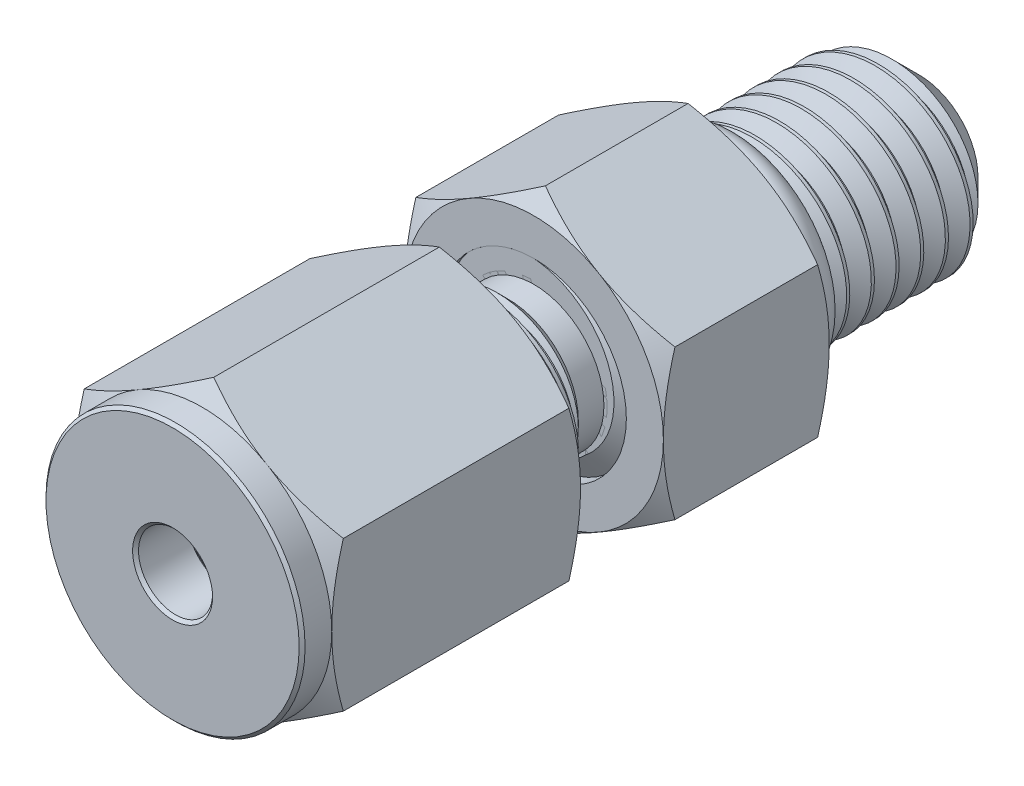
from build123d import *

# Parameters (mm, degrees)
BOSS_EXTRUDE1_DEPTH = 11.938
CHAMFER1_SIZE       = 0.127
SKETCH4_W           = 16.002
SKETCH4_H           = 3.96875
BOSS_EXTRUDE2_DEPTH = 7.112
SKETCH11_W          = 9.398
SKETCH11_H          = 3.96875
SKETCH15_R          = 0.8128
SKETCH17_OUTSIDE_W  = 107.468
SKETCH17_OUTSIDE_H  = 109.188
SKETCH17_OUTSIDE_R  = 5.55625
CUT_EXTRUDE1_DEPTH  = 25.146753449
CUT_EXTRUDE1_DRAFT  = -60
SKETCH18_OUTSIDE_W  = 88.128
SKETCH18_OUTSIDE_H  = 89.848
SKETCH18_OUTSIDE_R  = 5.55625
CUT_EXTRUDE2_DEPTH  = 19.563797191
CUT_EXTRUDE2_DRAFT  = -60
CHAMFER2_SIZE       = 1.42875
CUT_SWEEP1_PITCH    = 1.27
CUT_SWEEP2_PITCH    = 1.058333333
SKETCH19_W          = 7.112
SKETCH19_H          = 0.824889197


with BuildPart() as part:
    # Sketch2 → Boss-Extrude1 (new body)
    with BuildSketch(Plane.XY):
        Polygon((0, 6.415804866), (-5.55625, 3.207902433), (-5.55625, -3.207902433), (0, -6.415804866), (5.55625, -3.207902433), (5.55625, 3.207902433), align=None)
    extrude(amount=-BOSS_EXTRUDE1_DEPTH)

    # Sketch3 → Cut-Revolve1 (revolve, cut)
    with BuildSketch(Plane(origin=(0, 0, 0), x_dir=(0, 0, -1), z_dir=(1, 0, 0)), mode=Mode.PRIVATE) as cut_revolve1_sk:
        Polygon((0, 6.415804866), (0, 5.55625), (1.27, 5.55625), (1.766264233, 6.415804866), (11.441735767, 6.415804866), (11.938, 5.55625), (11.938, 6.415804866), (11.938, 7.275359733), (0, 7.275359733), align=None)
        Polygon((0, 1.5875), (0, 0), (11.938, 0), (11.938, 3.96875), (4.7752, 3.96875), (4.7752, 3.33375), (2.3876, 3.33375), (2.3876, 2.69875), (2.3876, 1.5875), align=None)
    revolve(cut_revolve1_sk.sketch.rotate(Axis((0, 0, 0), (0, 0, -1)), 90), axis=Axis((0, 0, 0), (0, 0, -1)), mode=Mode.SUBTRACT)

    # Chamfer1
    chamfer1_edges = [part.edges().sort_by_distance(p)[0] for p in [
        (-5.55625, 0, 0),
        (-1.5875, 0, -2.3876),
        (-1.5875, 0, 0),
    ]]
    chamfer(chamfer1_edges, length=CHAMFER1_SIZE)


with BuildPart() as body_2:
    # Sketch4 → Revolve1 (revolve)
    with BuildSketch(Plane(origin=(0, 0, 0), x_dir=(0, 0, -1), z_dir=(1, 0, 0)), mode=Mode.PRIVATE) as revolve1_sk:
        with Locations((14.605, 1.984375)):
            Rectangle(SKETCH4_W, SKETCH4_H)
    revolve(revolve1_sk.sketch.rotate(Axis((0, 0, -22.606), (0, 0, 1)), 90), axis=Axis((0, 0, -22.606), (0, 0, 1)))


with BuildPart() as body_3:
    # Sketch7 → Boss-Extrude2 (new body)
    with BuildSketch(Plane(origin=(0, 0, -22.606), x_dir=(-1, 0, 0), z_dir=(0, 0, -1))):
        Polygon((0, 6.415804866), (-5.55625, 3.207902433), (-5.55625, -3.207902433), (0, -6.415804866), (5.55625, -3.207902433), (5.55625, 3.207902433), align=None)
    extrude(amount=-BOSS_EXTRUDE2_DEPTH)


with BuildPart() as body_4:
    # Sketch9 → Revolve2 (revolve)
    with BuildSketch(Plane(origin=(0, 0, 0), x_dir=(0, 0, -1), z_dir=(1, 0, 0)), mode=Mode.PRIVATE) as revolve2_sk:
        Polygon((4.2926, 3.0988), (4.2926, 2.2733), (4.9784, 1.5875), (9.1694, 1.5875), (9.1694, 1.9812), align=None)
    revolve(revolve2_sk.sketch.rotate(Axis((0, 0, 0), (0, 0, -1)), 90), axis=Axis((0, 0, 0), (0, 0, -1)))


with BuildPart() as body_5:
    # Sketch10 → Revolve3 (revolve)
    with BuildSketch(Plane(origin=(0, 0, 0), x_dir=(0, 0, -1), z_dir=(1, 0, 0)), mode=Mode.PRIVATE) as revolve3_sk:
        Polygon((2.3876, 3.0734), (3.4036, 3.0734), (3.4036, 2.2733), (4.2926, 2.2733), (4.9784, 1.5875), (2.3876, 1.5875), align=None)
    revolve(revolve3_sk.sketch.rotate(Axis((0, 0, 0), (0, 0, -1)), 90), axis=Axis((0, 0, 0), (0, 0, -1)))


with BuildPart() as body_6:
    # Sketch11 → Revolve4 (revolve)
    with BuildSketch(Plane(origin=(0, 0, 0), x_dir=(0, 0, -1), z_dir=(1, 0, 0)), mode=Mode.PRIVATE) as revolve4_sk:
        with Locations((27.305, 1.984375)):
            Rectangle(SKETCH11_W, SKETCH11_H)
    revolve(revolve4_sk.sketch.rotate(Axis((0, 0, -22.606), (0, 0, -1)), 90), axis=Axis((0, 0, -22.606), (0, 0, -1)))


with BuildPart() as body_7:
    # Sketch15 → Revolve5 (revolve)
    with BuildSketch(Plane(origin=(0, 0, 0), x_dir=(0, 0, -1), z_dir=(1, 0, 0)), mode=Mode.PRIVATE) as revolve5_sk:
        with Locations((23.4188, 3.8481)):
            Circle(SKETCH15_R)
    revolve(revolve5_sk.sketch.rotate(Axis((0, 0, 0), (0, 0, -1)), 270), axis=Axis((0, 0, 0), (0, 0, -1)))


with BuildPart() as cut_extrude1_tool:
    # Sketch17 outside → Cut-Extrude1 (with draft: the straight prism first)
    with BuildSketch(Plane(origin=(0, 0, -22.606), x_dir=(-1, 0, 0), z_dir=(0, 0, -1))):
        Rectangle(SKETCH17_OUTSIDE_W, SKETCH17_OUTSIDE_H)
        with Locations(Location((0, 0, 0), (0, 0, 180))):
            Circle(SKETCH17_OUTSIDE_R, mode=Mode.SUBTRACT)
    extrude(amount=-CUT_EXTRUDE1_DEPTH)
    # Cut-Extrude1: the draft: its side faces are tilted about the plane it starts from
    cut_extrude1_sides = [cut_extrude1_tool.faces().sort_by_distance(p)[0] for p in [
        (0, -54.594, -10.032623275),
        (-53.734, 0, -10.032623275),
        (0, 54.594, -10.032623275),
        (53.734, 0, -10.032623275),
        (-5.55625, 0, -10.032623275),
    ]]
    draft(cut_extrude1_sides, Plane(origin=(0, 0, -22.606), x_dir=(-1, 0, 0), z_dir=(0, 0, -1)), CUT_EXTRUDE1_DRAFT)


with BuildPart() as body_3_1:
    add(body_3.part)

    # Cut-Extrude1: cut by cut_extrude1_tool
    add(cut_extrude1_tool.part, mode=Mode.SUBTRACT)


with BuildPart() as cut_extrude2_tool:
    # Sketch18 outside → Cut-Extrude2 (with draft: the straight prism first)
    with BuildSketch(Plane.XY.offset(-15.494)):
        Rectangle(SKETCH18_OUTSIDE_W, SKETCH18_OUTSIDE_H)
        Circle(SKETCH18_OUTSIDE_R, mode=Mode.SUBTRACT)
    extrude(amount=-CUT_EXTRUDE2_DEPTH)
    # Cut-Extrude2: the draft: its side faces are tilted about the plane it starts from
    cut_extrude2_sides = [cut_extrude2_tool.faces().sort_by_distance(p)[0] for p in [
        (0, -44.924, -25.275898595),
        (44.064, 0, -25.275898595),
        (0, 44.924, -25.275898595),
        (-44.064, 0, -25.275898595),
        (-5.55625, 0, -25.275898595),
    ]]
    draft(cut_extrude2_sides, Plane.XY.offset(-15.494), CUT_EXTRUDE2_DRAFT)


with BuildPart() as body_3_2:
    add(body_3_1.part)

    # Cut-Extrude2: cut by cut_extrude2_tool
    add(cut_extrude2_tool.part, mode=Mode.SUBTRACT)


with BuildPart() as cut_revolve5_tool:
    # Sketch16 → Cut-Revolve5 (revolve)
    with BuildSketch(Plane(origin=(0, 0, 0), x_dir=(0, 0, -1), z_dir=(1, 0, 0))):
        Polygon((32.004, 0), (6.604, 0), (6.604, 2.569104167), (10.887363636, 1.5875), (12.7, 1.5875), (12.7, 1.1811), (32.004, 1.1811), (33.5915, 1.1811), (33.5915, 0), align=None)
    revolve(axis=Axis((0, 0, -32.004), (0, 0, 1)))


with BuildPart() as body_3_3:
    add(body_3_2.part)

    # Cut-Revolve5: cut by cut_revolve5_tool
    add(cut_revolve5_tool.part, mode=Mode.SUBTRACT)

    # Sketch19 → Cut-Revolve7 (revolve, cut)
    with BuildSketch(Plane(origin=(0, 0, 0), x_dir=(0, 0, -1), z_dir=(1, 0, 0)), mode=Mode.PRIVATE) as cut_revolve7_sk:
        with Locations((19.05, 3.556305402)):
            Rectangle(SKETCH19_W, SKETCH19_H)
    revolve(cut_revolve7_sk.sketch.rotate(Axis((0, 0, 0), (0, 0, -1)), 90), axis=Axis((0, 0, 0), (0, 0, -1)), mode=Mode.SUBTRACT)


with BuildPart() as body_2_1:
    add(body_2.part)

    # Cut-Revolve5: cut by cut_revolve5_tool
    add(cut_revolve5_tool.part, mode=Mode.SUBTRACT)

    # Cut-Sweep1: the profile of Sketch6 screwed along a right-hand helix of 13.6 turns, 8 arcs to a turn; built about Z, then put on its axis
    cut_sweep1_z = Axis((0, 0, 0), (0, 0, 1))
    cut_sweep1_corners = [(3.143860803, 0, -0.635), (4.037490766, 0, -1.1509375), (4.037490766, 0, 0.0396875), (3.143860803, 0, -0.47625)]
    with BuildLine(mode=Mode.PRIVATE) as cut_sweep1_profile:
        Line(cut_sweep1_corners[0], cut_sweep1_corners[1])
        Line(cut_sweep1_corners[1], cut_sweep1_corners[2])
        Line(cut_sweep1_corners[2], cut_sweep1_corners[3])
        Line(cut_sweep1_corners[3], cut_sweep1_corners[0])
    cut_sweep1_cap = Face(cut_sweep1_profile.wire())
    cut_sweep1_turn_angles = [0, 22.5, 45, 67.5, 90, 112.5, 135, 157.5, 180, 202.5, 225, 247.5, 270, 292.5, 315, 337.5, 360]
    cut_sweep1_turn_weights = [1, 0.9238795325112867, 1, 0.9238795325112867, 1, 0.9238795325112867, 1, 0.9238795325112867, 1, 0.9238795325112867, 1, 0.9238795325112867, 1, 0.9238795325112867, 1, 0.9238795325112867, 1]
    cut_sweep1_turn_rails = [Edge.make_bspline([Vector(p[0], p[1], 0).rotate(cut_sweep1_z, cut_sweep1_turn_angles[k]) / cut_sweep1_turn_weights[k] + Vector(0, 0, p[2] + CUT_SWEEP1_PITCH * cut_sweep1_turn_angles[k] / 360) for k in range(17)], [0, 0, 0, 1, 1, 2, 2, 3, 3, 4, 4, 5, 5, 6, 6, 7, 7, 8, 8, 8], 2, cut_sweep1_turn_weights) for p in cut_sweep1_corners]
    cut_sweep1_turn_sides = [Face.make_surface_from_curves(cut_sweep1_turn_rails[p[0]], cut_sweep1_turn_rails[p[1]]) for p in [(0, 1), (1, 2), (2, 3), (3, 0)]]
    cut_sweep1_last_angles = [4680, 4702.5, 4725, 4747.5, 4770, 4792.5, 4815, 4837.5, 4860, 4878, 4896]
    cut_sweep1_last_weights = [1, 0.9238795325112867, 1, 0.9238795325112867, 1, 0.9238795325112867, 1, 0.9238795325112867, 1, 0.9510565162951486, 1]
    cut_sweep1_last_rails = [Edge.make_bspline([Vector(p[0], p[1], 0).rotate(cut_sweep1_z, cut_sweep1_last_angles[k]) / cut_sweep1_last_weights[k] + Vector(0, 0, p[2] + CUT_SWEEP1_PITCH * cut_sweep1_last_angles[k] / 360) for k in range(11)], [0, 0, 0, 1, 1, 2, 2, 3, 3, 4, 4, 5, 5, 5], 2, cut_sweep1_last_weights) for p in cut_sweep1_corners]
    cut_sweep1_last_sides = [Face.make_surface_from_curves(cut_sweep1_last_rails[p[0]], cut_sweep1_last_rails[p[1]]) for p in [(0, 1), (1, 2), (2, 3), (3, 0)]]
    cut_sweep1 = Plane(origin=(0, 0, -6.604), x_dir=(0, 1, 0), z_dir=(0, 0, -1)) * Solid(Shell([*[p.moved(Location((0, 0, CUT_SWEEP1_PITCH * i))) for i in range(13) for p in cut_sweep1_turn_sides], *cut_sweep1_last_sides, cut_sweep1_cap, cut_sweep1_cap.rotate(cut_sweep1_z, 4896).moved(Location((0, 0, CUT_SWEEP1_PITCH * 4896 / 360)))]))
    add(cut_sweep1, mode=Mode.SUBTRACT)

    # Sketch8 → Cut-Revolve2 (revolve, cut)
    with BuildSketch(Plane(origin=(0, 0, 0), x_dir=(0, 0, -1), z_dir=(1, 0, 0)), mode=Mode.PRIVATE) as cut_revolve2_sk:
        Polygon((6.604, 4.106231533), (6.604, 3.00637927), (7.703852263, 4.106231533), align=None)
        Polygon((15.494, 4.106231533), (13.294295474, 4.106231533), (14.394147737, 3.00637927), (15.494, 3.00637927), align=None)
    revolve(cut_revolve2_sk.sketch.rotate(Axis((0, 0, 0), (0, 0, -1)), 90), axis=Axis((0, 0, 0), (0, 0, -1)), mode=Mode.SUBTRACT)


with BuildPart() as body_6_1:
    add(body_6.part)

    # Cut-Revolve5: cut by cut_revolve5_tool
    add(cut_revolve5_tool.part, mode=Mode.SUBTRACT)

    # Chamfer2
    chamfer2_edges = [body_6_1.edges().sort_by_distance(p)[0] for p in [
        (-3.96875, 0, -32.004),
    ]]
    chamfer(chamfer2_edges, length=CHAMFER2_SIZE)

    # Cut-Sweep2: the profile of Sketch13 screwed along a right-hand helix of 9.88 turns, 8 arcs to a turn; built about Z, then put on its axis
    cut_sweep2_z = Axis((0, 0, 0), (0, 0, 1))
    cut_sweep2_corners = [(4.083317944, 0, 0.066145833), (4.026033972, 0, -0.959114583), (3.281342336, 0, -0.529166667), (3.281342336, 0, -0.396875)]
    with BuildLine(mode=Mode.PRIVATE) as cut_sweep2_profile:
        Line(cut_sweep2_corners[0], cut_sweep2_corners[1])
        Line(cut_sweep2_corners[1], cut_sweep2_corners[2])
        Line(cut_sweep2_corners[2], cut_sweep2_corners[3])
        Line(cut_sweep2_corners[3], cut_sweep2_corners[0])
    cut_sweep2_cap = Face(cut_sweep2_profile.wire())
    cut_sweep2_turn_angles = [0, 22.5, 45, 67.5, 90, 112.5, 135, 157.5, 180, 202.5, 225, 247.5, 270, 292.5, 315, 337.5, 360]
    cut_sweep2_turn_weights = [1, 0.9238795325112867, 1, 0.9238795325112867, 1, 0.9238795325112867, 1, 0.9238795325112867, 1, 0.9238795325112867, 1, 0.9238795325112867, 1, 0.9238795325112867, 1, 0.9238795325112867, 1]
    cut_sweep2_turn_rails = [Edge.make_bspline([Vector(p[0], p[1], 0).rotate(cut_sweep2_z, cut_sweep2_turn_angles[k]) / cut_sweep2_turn_weights[k] + Vector(0, 0, p[2] + CUT_SWEEP2_PITCH * cut_sweep2_turn_angles[k] / 360) for k in range(17)], [0, 0, 0, 1, 1, 2, 2, 3, 3, 4, 4, 5, 5, 6, 6, 7, 7, 8, 8, 8], 2, cut_sweep2_turn_weights) for p in cut_sweep2_corners]
    cut_sweep2_turn_sides = [Face.make_surface_from_curves(cut_sweep2_turn_rails[p[0]], cut_sweep2_turn_rails[p[1]]) for p in [(0, 1), (1, 2), (2, 3), (3, 0)]]
    cut_sweep2_last_angles = [3240, 3262.5, 3285, 3307.5, 3330, 3352.5, 3375, 3397.5, 3420, 3442.5, 3465, 3487.5, 3510, 3532.5, 3555, 3555.9, 3556.8]
    cut_sweep2_last_weights = [1, 0.9238795325112867, 1, 0.9238795325112867, 1, 0.9238795325112867, 1, 0.9238795325112867, 1, 0.9238795325112867, 1, 0.9238795325112867, 1, 0.9238795325112867, 1, 0.999876632481662, 1]
    cut_sweep2_last_rails = [Edge.make_bspline([Vector(p[0], p[1], 0).rotate(cut_sweep2_z, cut_sweep2_last_angles[k]) / cut_sweep2_last_weights[k] + Vector(0, 0, p[2] + CUT_SWEEP2_PITCH * cut_sweep2_last_angles[k] / 360) for k in range(17)], [0, 0, 0, 1, 1, 2, 2, 3, 3, 4, 4, 5, 5, 6, 6, 7, 7, 8, 8, 8], 2, cut_sweep2_last_weights) for p in cut_sweep2_corners]
    cut_sweep2_last_sides = [Face.make_surface_from_curves(cut_sweep2_last_rails[p[0]], cut_sweep2_last_rails[p[1]]) for p in [(0, 1), (1, 2), (2, 3), (3, 0)]]
    cut_sweep2 = Plane(origin=(0, 0, -33.274), x_dir=(0, 1, 0), z_dir=(0, 0, 1)) * Solid(Shell([*[p.moved(Location((0, 0, CUT_SWEEP2_PITCH * i))) for i in range(9) for p in cut_sweep2_turn_sides], *cut_sweep2_last_sides, cut_sweep2_cap, cut_sweep2_cap.rotate(cut_sweep2_z, 3556.8).moved(Location((0, 0, CUT_SWEEP2_PITCH * 3556.8 / 360)))]))
    add(cut_sweep2, mode=Mode.SUBTRACT)

    # Sketch14 → Cut-Revolve4 (revolve, cut)
    with BuildSketch(Plane(origin=(0, 0, 0), x_dir=(0, 0, -1), z_dir=(1, 0, 0)), mode=Mode.PRIVATE) as cut_revolve4_sk:
        Polygon((24.439087105, 4.083317944), (22.606, 4.083317944), (22.606, 3.166774392), (23.522543552, 3.166774392), align=None)
    revolve(cut_revolve4_sk.sketch.rotate(Axis((0, 0, 0), (0, 0, -1)), 90), axis=Axis((0, 0, 0), (0, 0, -1)), mode=Mode.SUBTRACT)


with BuildPart() as part_1:
    add(part.part)

    # Combine3: union body 5, body 4
    add(body_5.part)
    add(body_4.part)


with BuildPart() as cut_revolve7_piece_1:
    # of the separate pieces the step leaves, piece 1, a body of its own (cut_revolve7_pieces)
    add(body_3_3.part.solids().sort_by_distance((0, 6.415804866, -22.109735767))[0])


with BuildPart() as cut_revolve7_piece_2:
    # of the separate pieces the step leaves, piece 2, a body of its own (cut_revolve7_pieces)
    add(body_3_3.part.solids().sort_by_distance((3.143860803, 0, -22.606))[0])


solid = Compound([body_7.part, body_2_1.part, body_6_1.part, part_1.part, cut_revolve7_piece_1.part, cut_revolve7_piece_2.part])
